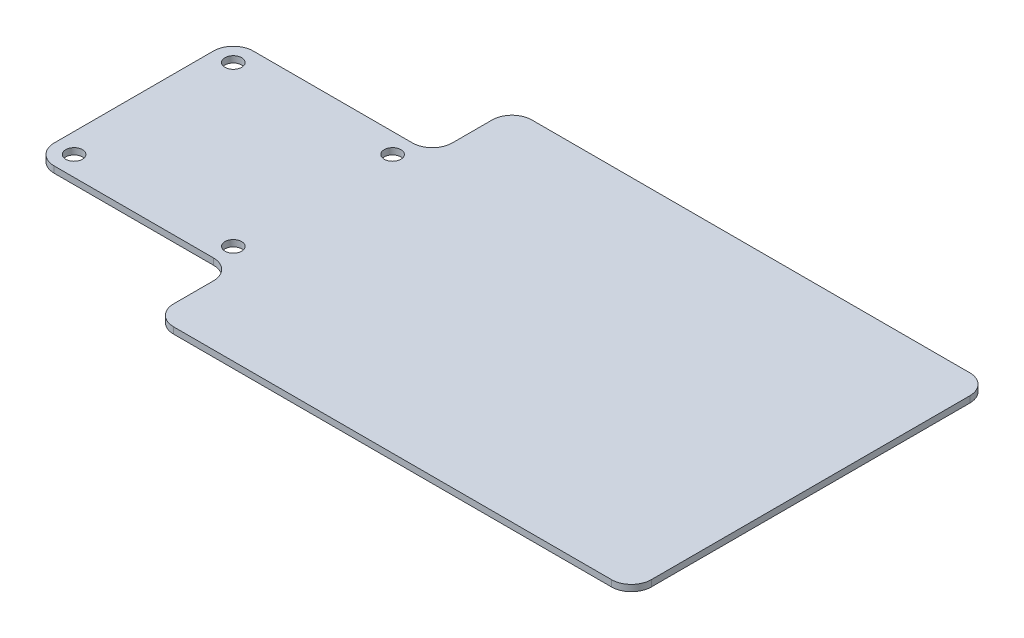
from build123d import *

# Parameters (mm, degrees)
BOSS_EXTRUDE1_DEPTH = 1.6
FILLET1_R           = 5
SKETCH2_R           = 2.1
CUT_EXTRUDE1_DEPTH  = 152.830695184


with BuildPart() as part:
    # Sketch1 → Boss-Extrude1 (new body)
    with BuildSketch(Plane(origin=(0, 0, 0), x_dir=(1, 0, 0), z_dir=(0, 1, 0))):
        Polygon((-25, 25), (25, 25), (25, 45), (145, 45), (145, -45), (25, -45), (25, -25), (-25, -25), align=None)
    extrude(amount=BOSS_EXTRUDE1_DEPTH)

    # Fillet1
    fillet1_edges = [part.edges().sort_by_distance(p)[0] for p in [
        (145, 0.8, -45),
        (145, 0.8, 45),
        (25, 0.8, -45),
        (25, 0.8, -25),
        (-25, 0.8, -25),
        (-25, 0.8, 25),
        (25, 0.8, 25),
        (25, 0.8, 45),
    ]]
    fillet(fillet1_edges, radius=FILLET1_R)

    # Sketch2 → Cut-Extrude1 (cut, through all)
    with BuildSketch(Plane(origin=(0, 1.6, 0), x_dir=(1, 0, 0), z_dir=(0, 1, 0))):
        with Locations((-20, 20)):
            Circle(SKETCH2_R)
        with Locations((20, 20)):
            Circle(SKETCH2_R)
        with Locations((20, -20)):
            Circle(SKETCH2_R)
        with Locations((-20, -20)):
            Circle(SKETCH2_R)
    extrude(amount=-CUT_EXTRUDE1_DEPTH, mode=Mode.SUBTRACT)


solid = part.part
